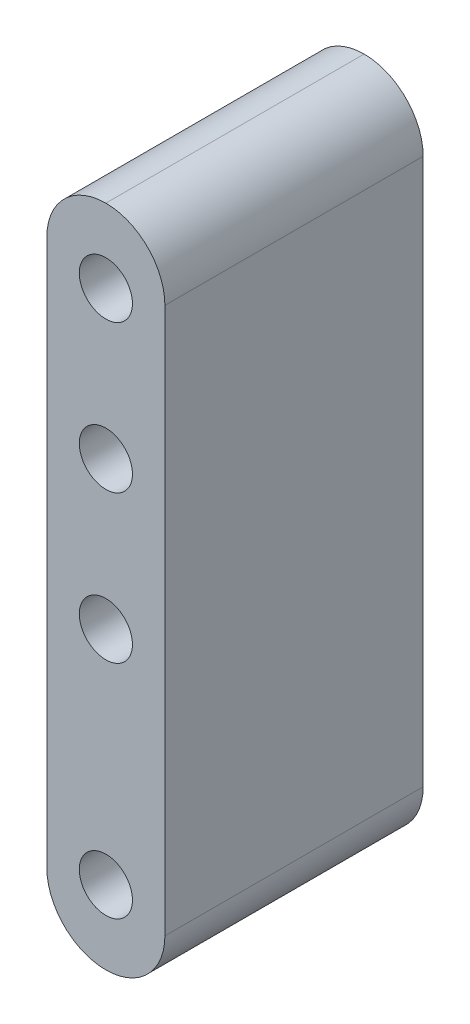
from build123d import *

# Parameters (mm, degrees)
SKETCH1_W           = 10.16
SKETCH1_H           = 57.15
SKETCH1_R           = 2.286
BOSS_EXTRUDE1_DEPTH = 22.225
FILLET1_R           = 5.08


with BuildPart() as part:
    # Sketch1 → Boss-Extrude1 (new body)
    with BuildSketch(Plane.XY):
        with Locations((5.08, 28.575)):
            Rectangle(SKETCH1_W, SKETCH1_H)
        with Locations((5.08, 6.35)):
            Circle(SKETCH1_R, mode=Mode.SUBTRACT)
        with Locations((5.08, 25.4)):
            Circle(SKETCH1_R, mode=Mode.SUBTRACT)
        with Locations((5.08, 38.1)):
            Circle(SKETCH1_R, mode=Mode.SUBTRACT)
        with Locations((5.08, 50.8)):
            Circle(SKETCH1_R, mode=Mode.SUBTRACT)
    extrude(amount=BOSS_EXTRUDE1_DEPTH)

    # Fillet1
    fillet1_edges = [part.edges().sort_by_distance(p)[0] for p in [
        (10.16, 0, 11.1125),
        (0, 0, 11.1125),
        (0, 57.15, 11.1125),
        (10.16, 57.15, 11.1125),
    ]]
    fillet(fillet1_edges, radius=FILLET1_R - 0.0001)  # a hair under: the kernel refuses the full size


solid = part.part
